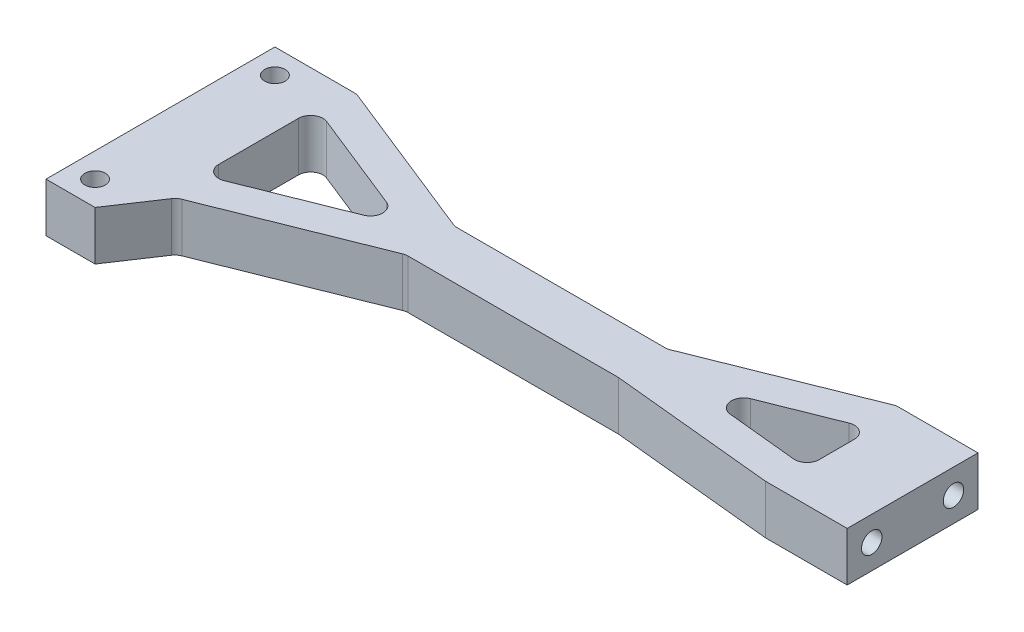
from build123d import *

# Parameters (mm, degrees)
BOSS_EXTRUDE1_DEPTH         = 6
TAP_DRILL_FOR_M3_TAP3_D     = 2.5
TAP_DRILL_FOR_M3_TAP3_DEPTH = 10
TAP_DRILL_FOR_M3_TAP3_TIP   = 0.751075774
TAP_DRILL_FOR_M3_TAP2_D     = 2.5
TAP_DRILL_FOR_M3_TAP2_DEPTH = 8
TAP_DRILL_FOR_M3_TAP2_TIP   = 0.751075774
TAP_DRILL_FOR_M3_TAP1_D     = 2.5
TAP_DRILL_FOR_M3_TAP1_DEPTH = 8
TAP_DRILL_FOR_M3_TAP1_TIP   = 0.751075774
FILLET1_R                   = 1.5


with BuildPart() as part:
    # Sketch2 → Boss-Extrude1 (new body)
    with BuildSketch(Plane(origin=(0, 0, 0), x_dir=(1, 0, 0), z_dir=(0, 1, 0))):
        Polygon((56, -8), (76, 0), (86, 0), (86, -16), (76, -16), (56, -14), (30, -14), (10, -22), (6, -28), (0, -28), (0, 0), (10, 0), (30, -8), align=None)
        Polygon((9, -3.908131846), (26.729670386, -11), (9, -18.091868154), align=None, mode=Mode.SUBTRACT)
        Polygon((60.656164188, -10.44566617), (77, -12.080049752), (77, -3.908131846), align=None, mode=Mode.SUBTRACT)
    extrude(amount=BOSS_EXTRUDE1_DEPTH)

    # Tap Drill for M3 Tap3
    with Locations(Plane(origin=(0, 6, 0), x_dir=(1, 0, 0), z_dir=(0, 1, 0))):
        with Locations((3, -3), (3, -25)):
            Hole(TAP_DRILL_FOR_M3_TAP3_D / 2, depth=TAP_DRILL_FOR_M3_TAP3_DEPTH)
            with Locations((0, 0, -(TAP_DRILL_FOR_M3_TAP3_DEPTH + TAP_DRILL_FOR_M3_TAP3_TIP / 2))):  # 118° drill point
                Cone(0, TAP_DRILL_FOR_M3_TAP3_D / 2, TAP_DRILL_FOR_M3_TAP3_TIP, mode=Mode.SUBTRACT)

    # Tap Drill for M3 Tap2
    with Locations(Plane(origin=(86, 0.779165189, 7.640466368), x_dir=(0, 0, -1), z_dir=(1, 0, 0))):
        with Locations((-5.359533632, 2.220834811), (4.640466368, 2.220834811)):
            Hole(TAP_DRILL_FOR_M3_TAP2_D / 2, depth=TAP_DRILL_FOR_M3_TAP2_DEPTH)
            with Locations((0, 0, -(TAP_DRILL_FOR_M3_TAP2_DEPTH + TAP_DRILL_FOR_M3_TAP2_TIP / 2))):  # 118° drill point
                Cone(0, TAP_DRILL_FOR_M3_TAP2_D / 2, TAP_DRILL_FOR_M3_TAP2_TIP, mode=Mode.SUBTRACT)

    # Tap Drill for M3 Tap1
    with Locations(Plane.ZY):
        with Locations((8, 3), (18, 3)):
            Hole(TAP_DRILL_FOR_M3_TAP1_D / 2, depth=TAP_DRILL_FOR_M3_TAP1_DEPTH)
            with Locations((0, 0, -(TAP_DRILL_FOR_M3_TAP1_DEPTH + TAP_DRILL_FOR_M3_TAP1_TIP / 2))):  # 118° drill point
                Cone(0, TAP_DRILL_FOR_M3_TAP1_D / 2, TAP_DRILL_FOR_M3_TAP1_TIP, mode=Mode.SUBTRACT)

    # Fillet1
    fillet1_edges = [part.edges().sort_by_distance(p)[0] for p in [
        (76, 3, 0),
        (56, 3, 8),
        (60.656164188, 3, 10.44566617),
        (77, 3, 12.080049752),
        (77, 3, 3.908131846),
        (30, 3, 14),
        (10, 3, 22),
        (30, 3, 8),
        (10, 3, 0),
        (9, 3, 18.091868154),
        (26.729670386, 3, 11),
        (9, 3, 3.908131846),
    ]]
    fillet(fillet1_edges, radius=FILLET1_R)


solid = part.part
